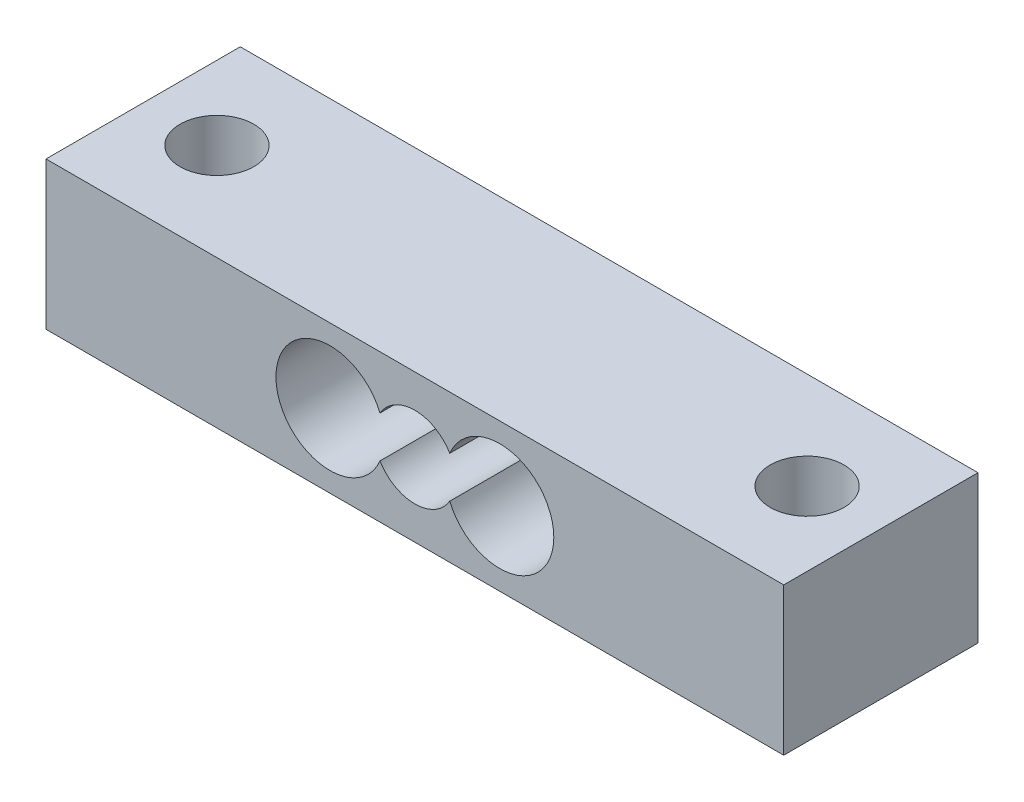
from build123d import *

# Parameters (mm, degrees)
SKETCH1_W           = 30
SKETCH1_H           = 6
BOSS_EXTRUDE1_DEPTH = 7.9
SKETCH2_R           = 1.5
CUT_EXTRUDE1_DEPTH  = 32.597626493


with BuildPart() as part:
    # Sketch1 → Boss-Extrude1 (new body)
    with BuildSketch(Plane.XY):
        with Locations((15, 3)):
            Rectangle(SKETCH1_W, SKETCH1_H)
        with BuildLine():
            ThreePointArc((13.581884058, 3.843473281), (9.35, 3), (13.581884058, 2.156526719))
            ThreePointArc((13.581884058, 2.156526719), (15, 1.35), (16.418115942, 2.156526719))
            ThreePointArc((16.418115942, 2.156526719), (20.65, 3), (16.418115942, 3.843473281))
            ThreePointArc((16.418115942, 3.843473281), (15, 4.65), (13.581884058, 3.843473281))
        make_face(mode=Mode.SUBTRACT)
    extrude(amount=BOSS_EXTRUDE1_DEPTH)

    # Sketch2 → Cut-Extrude1 (cut, through all)
    with BuildSketch(Plane(origin=(0, 6, 0), x_dir=(1, 0, 0), z_dir=(0, 1, 0))):
        with Locations((3, -3.95)):
            Circle(SKETCH2_R)
        with Locations((27, -3.95)):
            Circle(SKETCH2_R)
    extrude(amount=-CUT_EXTRUDE1_DEPTH, mode=Mode.SUBTRACT)


solid = part.part
